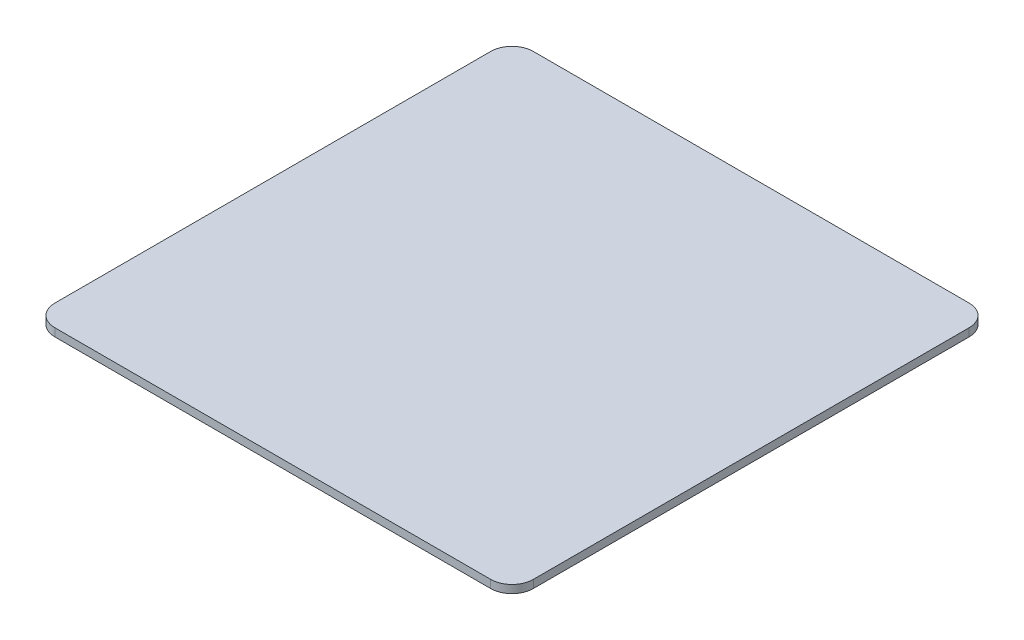
from build123d import *

# Parameters (mm, degrees)
RESSALTO_EXTRUS_O1_DEPTH = 3
ESBO_O2_R                = 3.5
RESSALTO_EXTRUS_O2_DEPTH = 5


with BuildPart() as part:
    # Esboço1 → Ressalto-extrusão1 (new body)
    with BuildSketch(Plane(origin=(0, 0, 0), x_dir=(1, 0, 0), z_dir=(0, 1, 0))):
        with BuildLine():
            Line((82, -90), (-82, -90))
            ThreePointArc((-82, -90), (-87.656854249, -87.656854249), (-90, -82))
            Line((-90, -82), (-90, 82))
            ThreePointArc((-90, 82), (-87.656854249, 87.656854249), (-82, 90))
            Line((-82, 90), (82, 90))
            ThreePointArc((82, 90), (87.656854249, 87.656854249), (90, 82))
            Line((90, 82), (90, -82))
            ThreePointArc((90, -82), (87.656854249, -87.656854249), (82, -90))
        make_face()
    extrude(amount=RESSALTO_EXTRUS_O1_DEPTH)

    # Esboço2 → Ressalto-extrusão2 (add)
    with BuildSketch(Plane(origin=(0, 0, 0), x_dir=(-1, 0, 0), z_dir=(0, -1, 0))):
        with Locations((79, -62)):
            Circle(ESBO_O2_R)
        with Locations((-79, -62)):
            Circle(ESBO_O2_R)
        with Locations((-79, 62)):
            Circle(ESBO_O2_R)
        with Locations((79, 62)):
            Circle(ESBO_O2_R)
    extrude(amount=RESSALTO_EXTRUS_O2_DEPTH)


solid = part.part
